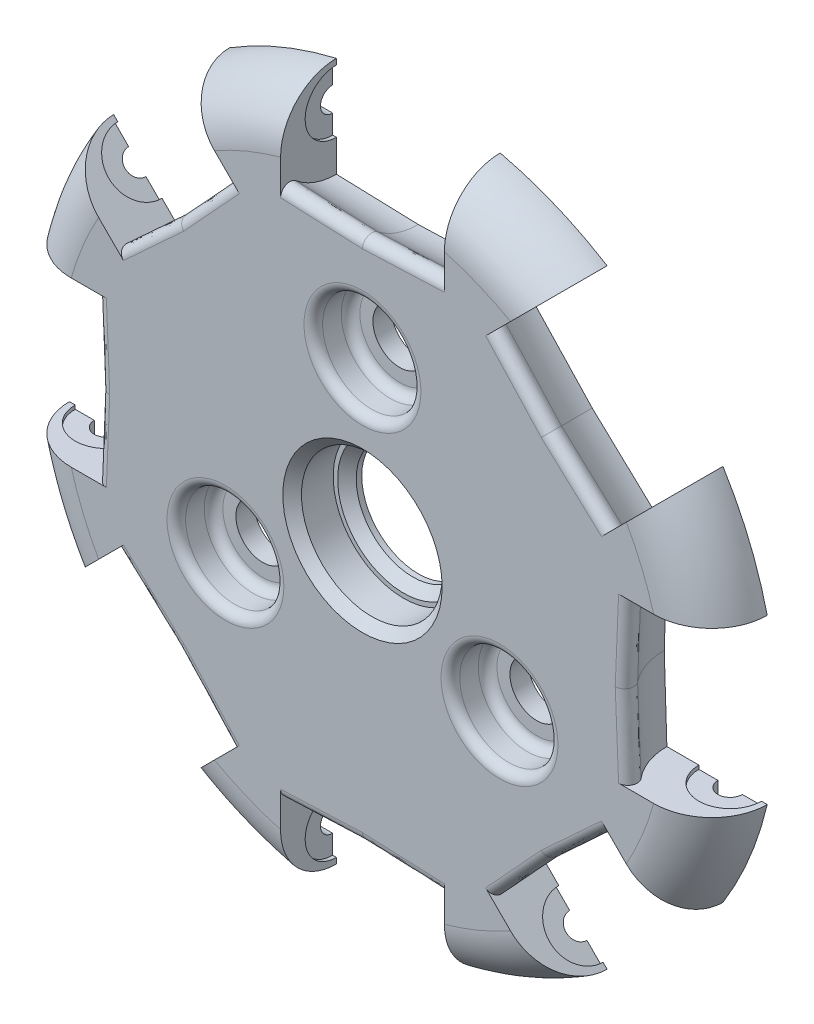
from build123d import *

# Parameters (mm, degrees)
SKETCH1_R                = 30.559375
BOSS_EXTRUDE1_DEPTH      = 4.7625
FILLET1_R                = 4.7625
FILLET2_R                = 0.79375
CIRPATTERN1_COUNT        = 8
FILLET2_OF_CIRPATTERN1_R = 0.79375
SKETCH2_R                = 2.286
CUT_EXTRUDE1_DEPTH       = 43.342080368
SKETCH3_R                = 4.191
CUT_EXTRUDE2_DEPTH       = 3.175
FILLET3_R                = 0.79375
CIRPATTERN2_COUNT        = 3
FILLET3_OF_CIRPATTERN2_R = 0.79375
SKETCH4_R                = 4.826
CUT_EXTRUDE3_DEPTH       = 43.342080368
SKETCH5_R                = 6
CUT_EXTRUDE4_DEPTH       = 3.5
CHAMFER1_SIZE            = 0.79375


# Read off the part's stored shape, not the designer's step: Cavity2
with BuildPart() as part:
    # Sketch1 → Boss-Extrude1 (new body)
    with BuildSketch(Plane.XY):
        with Locations(Location((0, 0, 0), (0, 0, 180))):
            Circle(SKETCH1_R)
    extrude(amount=BOSS_EXTRUDE1_DEPTH)

    # Fillet1
    fillet1_edges = [part.edges().sort_by_distance(p)[0] for p in [
        (30.559375, 0, 4.7625),
    ]]
    fillet(fillet1_edges, radius=FILLET1_R - 0.0001)  # a hair under: the kernel refuses the full size

    # Cavity2 outline → Cavity2 (revolve, cut)
    with BuildSketch(Plane(origin=(0, 26.590625, 0), x_dir=(0, 1, 0), z_dir=(0, 0, -1))):
        Polygon((1.0414, 9.525), (0, 9.525), (0, -9.525), (1.0414, -9.525), (1.0414, -7.3025), (2.667, -7.3025), (2.667, -6.985), (5.3975, -6.985), (5.61975, 0), (5.397499997, 6.985000084), (2.667, 6.985), (2.667, 7.3025), (1.0414, 7.3025), align=None)
    cavity2 = revolve(axis=Axis((0, 26.590625, 0), (1, 0, 0)), mode=Mode.SUBTRACT)

    # Fillet2
    fillet2_edges = [part.edges().sort_by_distance(p)[0] for p in [
        (3.492921025, 23.822341136, 4.7625),
        (-3.492920983, 23.822341133, 4.7625),
    ]]
    fillet(fillet2_edges, radius=FILLET2_R)

    # CirPattern1: Cavity2 ×8 about axis
    cirpattern1_axis = Axis((0, 0, 4.7625), (0, 0, 1))
    for i in range(1, CIRPATTERN1_COUNT):
        add(cavity2.rotate(cirpattern1_axis, i * 360 / CIRPATTERN1_COUNT), mode=Mode.SUBTRACT)

    # Fillet2 of CirPattern1
    fillet2_of_cirpattern1_edges = [part.edges().sort_by_distance(p)[0] for p in [
        (-14.375070818, 19.314807105, 4.7625),
        (-19.314807073, 14.375070846, 4.7625),
        (-23.822341136, 3.492921025, 4.7625),
        (-23.822341133, -3.492920983, 4.7625),
        (-19.314807105, -14.375070818, 4.7625),
        (-14.375070846, -19.314807073, 4.7625),
        (-3.492921025, -23.822341136, 4.7625),
        (3.492920983, -23.822341133, 4.7625),
        (14.375070818, -19.314807105, 4.7625),
        (19.314807073, -14.375070846, 4.7625),
        (23.822341136, -3.492921025, 4.7625),
        (23.822341133, 3.492920983, 4.7625),
        (19.314807105, 14.375070818, 4.7625),
        (14.375070846, 19.314807073, 4.7625),
    ]]
    fillet(fillet2_of_cirpattern1_edges, radius=FILLET2_OF_CIRPATTERN1_R)

    # Sketch2 → Cut-Extrude1 (cut, through all)
    with BuildSketch(Plane(origin=(0, 0, 0), x_dir=(-1, 0, 0), z_dir=(0, 0, -1))):
        with Locations((-11.685930292, -6.746875)):
            Circle(SKETCH2_R)
        with Locations((11.685930292, -6.746875)):
            Circle(SKETCH2_R)
        with Locations((0, 13.49375)):
            Circle(SKETCH2_R)
    extrude(amount=-CUT_EXTRUDE1_DEPTH, mode=Mode.SUBTRACT)

    # Sketch3 → Cut-Extrude2 (cut)
    with BuildSketch(Plane.XY.offset(4.7625)):
        with Locations((0, 13.49375)):
            Circle(SKETCH3_R)
    cut_extrude2 = extrude(amount=-CUT_EXTRUDE2_DEPTH, mode=Mode.SUBTRACT)

    # Fillet3
    fillet3_edges = [part.edges().sort_by_distance(p)[0] for p in [
        (-4.191, 13.49375, 4.7625),
        (-4.191, 13.49375, 1.5875),
    ]]
    fillet(fillet3_edges, radius=FILLET3_R)

    # CirPattern2: Cut-Extrude2 ×3 about axis
    cirpattern2_axis = Axis((0, 0, 0), (0, 0, 1))
    for i in range(1, CIRPATTERN2_COUNT):
        add(cut_extrude2.rotate(cirpattern2_axis, i * 360 / CIRPATTERN2_COUNT), mode=Mode.SUBTRACT)

    # Fillet3 of CirPattern2
    fillet3_of_cirpattern2_edges = [part.edges().sort_by_distance(p)[0] for p in [
        (-9.590430292, -10.376387467, 4.7625),
        (-9.590430292, -10.376387467, 1.5875),
        (13.781430292, -3.117362533, 4.7625),
        (13.781430292, -3.117362533, 1.5875),
    ]]
    fillet(fillet3_of_cirpattern2_edges, radius=FILLET3_OF_CIRPATTERN2_R)

    # Sketch4 → Cut-Extrude3 (cut, through all)
    with BuildSketch(Plane(origin=(0, 0, 0), x_dir=(-1, 0, 0), z_dir=(0, 0, -1))):
        Circle(SKETCH4_R)
    extrude(amount=-CUT_EXTRUDE3_DEPTH, mode=Mode.SUBTRACT)

    # Sketch5 → Cut-Extrude4 (cut)
    with BuildSketch(Plane.XY.offset(4.7625)):
        Circle(SKETCH5_R)
    extrude(amount=-CUT_EXTRUDE4_DEPTH, mode=Mode.SUBTRACT)

    # Chamfer1
    chamfer1_edges = [part.edges().sort_by_distance(p)[0] for p in [
        (-6, 0, 4.7625),
        (4.826, 0, 1.2625),
    ]]
    chamfer(chamfer1_edges, length=CHAMFER1_SIZE)


solid = part.part
